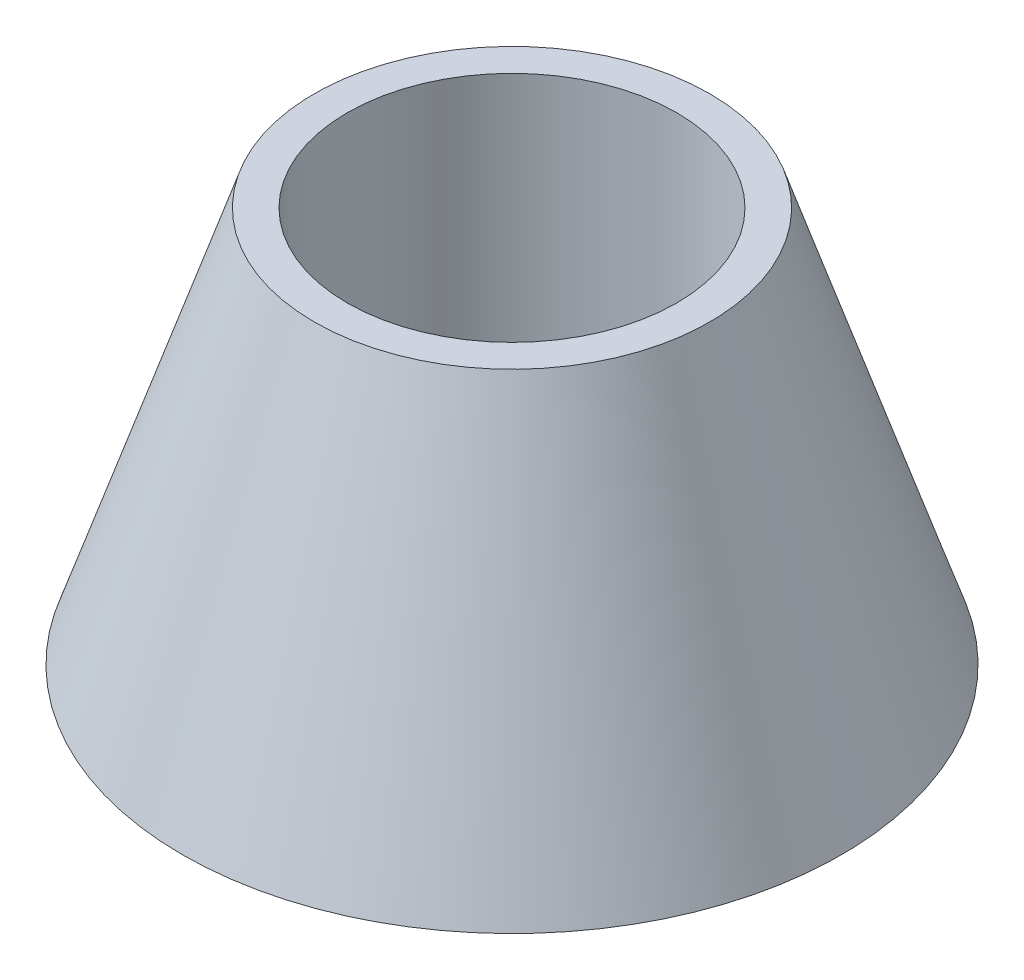
from build123d import *


with BuildPart() as part:
    # Szkic1 → Obrót1 (revolve)
    with BuildSketch(Plane.XY):
        Polygon((5, 0.755294412), (10, 0.755294412), (6, 12.755294412), (5, 12.755294412), align=None)
    revolve(axis=Axis((0, 0, 0), (0, 1, 0)))


solid = part.part
